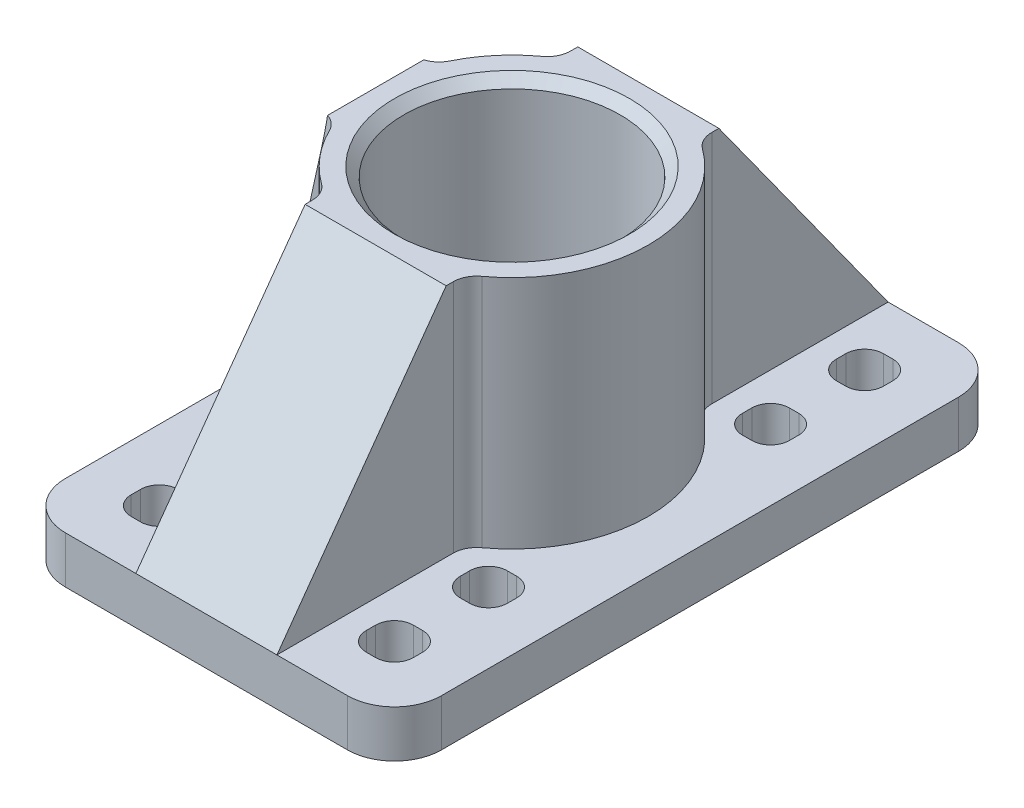
from build123d import *

# Parameters (mm, degrees)
SKETCH1_W                       = 40
SKETCH1_H                       = 65
SKETCH1_W_2                     = 5
SKETCH1_H_2                     = 5
MOUNTBASE_DEPTH                 = 5
SKETCH4_R                       = 11.5
PIPEBASE_DEPTH                  = 25
RIB3_REACH                      = 50.541
SKETCH6_WALL_W                  = 124.680290668
SKETCH6_WALL_H                  = 10
RIB5_REACH                      = 50.541
SKETCH7_WALL_W                  = 129.888282796
SKETCH7_WALL_H                  = 15
BASEFILLET_R                    = 5
PIPEFILLET_R                    = 2.5
INNERMATERIALREMOVAL_DEPTH      = 46.620718977
INNERMATERIALREMOVAL_DEPTH_BACK = 46.620718977
SKETCH8_R                       = 9
PIPECHAMFER_SIZE                = 1
FILLET5_R                       = 2
CUT_EXTRUDE2_START              = -25
CUT_EXTRUDE2_DEPTH              = 25
SKETCH10_W                      = 7
SKETCH10_H                      = 20
CUT_EXTRUDE3_DEPTH              = 3
FILLET6_R                       = 2


with BuildPart() as part:
    # Sketch1 → MountBase (new body)
    with BuildSketch(Plane(origin=(0, 0, 0), x_dir=(1, 0, 0), z_dir=(0, 1, 0))):
        Rectangle(SKETCH1_W, SKETCH1_H)
        with Locations((-12.5, 15)):
            Rectangle(SKETCH1_W_2, SKETCH1_H_2, mode=Mode.SUBTRACT)
        with Locations((-12.5, -15)):
            Rectangle(SKETCH1_W_2, SKETCH1_H_2, mode=Mode.SUBTRACT)
        with Locations((12.5, 15)):
            Rectangle(SKETCH1_W_2, SKETCH1_H_2, mode=Mode.SUBTRACT)
        with Locations((12.5, -15)):
            Rectangle(SKETCH1_W_2, SKETCH1_H_2, mode=Mode.SUBTRACT)
        with Locations((-12.5, -25)):
            Rectangle(SKETCH1_W_2, SKETCH1_H_2, mode=Mode.SUBTRACT)
        with Locations((12.5, -25)):
            Rectangle(SKETCH1_W_2, SKETCH1_H_2, mode=Mode.SUBTRACT)
        with Locations((-12.5, 25)):
            Rectangle(SKETCH1_W_2, SKETCH1_H_2, mode=Mode.SUBTRACT)
        with Locations((12.5, 25)):
            Rectangle(SKETCH1_W_2, SKETCH1_H_2, mode=Mode.SUBTRACT)
    extrude(amount=MOUNTBASE_DEPTH)

    # Sketch4 → PipeBase (add)
    with BuildSketch(Plane(origin=(0, 5, 0), x_dir=(1, 0, 0), z_dir=(0, 1, 0))):
        with BuildLine():
            Line((-14.5, 5), (-14.5, -5))
            Line((-14.5, -5), (-13.610657589, -5))
            ThreePointArc((-13.610657589, -5), (-11.186634071, -9.225465742), (-7.5, -12.409673646))
            Line((-7.5, -12.409673646), (-7.5, -14.5))
            Line((-7.5, -14.5), (7.5, -14.5))
            Line((7.5, -14.5), (7.5, -12.409673646))
            ThreePointArc((7.5, -12.409673646), (11.186634071, -9.225465742), (13.610657589, -5))
            Line((13.610657589, -5), (14.5, -5))
            Line((14.5, -5), (14.5, 5))
            Line((14.5, 5), (13.610657589, 5))
            ThreePointArc((13.610657589, 5), (11.186634071, 9.225465742), (7.5, 12.409673646))
            Line((7.5, 12.409673646), (7.5, 14.5))
            Line((7.5, 14.5), (-7.5, 14.5))
            Line((-7.5, 14.5), (-7.5, 12.409673646))
            ThreePointArc((-7.5, 12.409673646), (-11.186634071, 9.225465742), (-13.610657589, 5))
            Line((-13.610657589, 5), (-14.5, 5))
        make_face()
        with Locations(Location((0, 0, 0), (0, 0, 270))):
            Circle(SKETCH4_R, mode=Mode.SUBTRACT)
    extrude(amount=PIPEBASE_DEPTH)

    # Sketch6 wall → Rib3 (add, up to next)
    with BuildSketch(Plane(origin=(-17.25, 17.5, 0), x_dir=(-0.214861782675, -0.976644466705, 0), z_dir=(0.976644466705, -0.214861782675, 0)), mode=Mode.PRIVATE) as rib3_sk1:
        Rectangle(SKETCH6_WALL_W, SKETCH6_WALL_H)
    rib3_tool1 = extrude(rib3_sk1.sketch, amount=RIB3_REACH, mode=Mode.PRIVATE) - part.part
    rib3 = rib3_tool1.solids().sort_by_distance((-17.25, 17.5, 0))[0]
    add(rib3)

    # Mirror1: Rib3 across plane
    add(rib3.mirror(Plane(origin=(0, 0, 0), x_dir=(0, 0, 1), z_dir=(1, 0, 0))))

    # Sketch7 wall → Rib5 (add, up to next)
    with BuildSketch(Plane(origin=(0, 17.5, 23.5), x_dir=(0, -0.811534341451, 0.584304725845), z_dir=(0, -0.584304725845, -0.811534341451)), mode=Mode.PRIVATE) as rib5_sk1:
        Rectangle(SKETCH7_WALL_W, SKETCH7_WALL_H)
    rib5_tool1 = extrude(rib5_sk1.sketch, amount=RIB5_REACH, mode=Mode.PRIVATE) - part.part
    rib5 = rib5_tool1.solids().sort_by_distance((0, 17.5, 23.5))[0]
    add(rib5)

    # Mirror2: Rib5 across plane
    add(rib5.mirror(Plane.XY))

    # BaseFillet
    basefillet_edges = [part.edges().sort_by_distance(p)[0] for p in [
        (20, 2.5, 32.5),
        (-20, 2.5, 32.5),
        (-20, 2.5, -32.5),
        (20, 2.5, -32.5),
    ]]
    fillet(basefillet_edges, radius=BASEFILLET_R)

    # PipeFillet
    # the kernel refuses this fillet: 2.5 mm, written as the material it adds along each edge
    with BuildSketch(Plane(origin=(-13.610657589, 0.886278216, -5), x_dir=(-1, 0, 0), z_dir=(0, 1, 0))) as pipefillet_piece_1_section:
        with BuildLine():
            CenterArc((1.645488714, -2.5), PIPEFILLET_R, 90, 63.821031296)
            ThreePointArc((-0.598062213, -1.397058824), (-0.280715993, -0.706369867), (0, 0))
            Line((0, 0), (1.645488714, 0))
        make_face()
    pipefillet_piece_1 = extrude(amount=29.113721784, mode=Mode.PRIVATE)
    pipefillet_piece_1 = split(pipefillet_piece_1, bisect_by=Plane(origin=(-20.148077302, 4.326921354, -5.304724049), z_dir=(0.976644466705111, -0.2148617826750244, 0)), keep=Keep.TOP, mode=Mode.PRIVATE)
    add(pipefillet_piece_1)
    with BuildSketch(Plane(origin=(-7.5, 1.654866403, -12.409673646), x_dir=(-0.8330213423374977, 0, 0.5532408546105696), z_dir=(0, 1, 0))) as pipefillet_piece_2:
        with BuildLine():
            CenterArc((1.342287528, -2.497729208), PIPEFILLET_R, 92.442244575, 53.968120928)
            Line((-0.740265828, -1.114627072), (0, 0))
            ThreePointArc((0, 0), (0.617878386, -0.013170592), (1.235756772, 0))
        make_face()
    extrude(amount=28.345133597)
    with BuildSketch(Plane(origin=(-13.610657589, 0.886278216, 5), x_dir=(-1, 0, 0), z_dir=(0, 1, 0))) as pipefillet_piece_3_section:
        with BuildLine():
            CenterArc((1.645488714, 2.5), PIPEFILLET_R, 206.178968704, 63.821031296)
            ThreePointArc((-0.598062213, 1.397058824), (-0.280715993, 0.706369867), (0, 0))
            Line((0, 0), (1.645488714, 0))
        make_face()
    pipefillet_piece_3 = extrude(amount=29.113721784, mode=Mode.PRIVATE)
    pipefillet_piece_3 = split(pipefillet_piece_3, bisect_by=Plane(origin=(-20.148077302, 4.326921354, 5.304724049), z_dir=(0.976644466705111, -0.2148617826750244, 0)), keep=Keep.TOP, mode=Mode.PRIVATE)
    add(pipefillet_piece_3)
    with BuildSketch(Plane(origin=(-7.5, 1.654866403, 12.409673646), x_dir=(-0.8330213423374981, 0, -0.5532408546105689), z_dir=(0, 1, 0))) as pipefillet_piece_4:
        with BuildLine():
            CenterArc((1.342287528, 2.497729208), PIPEFILLET_R, 213.589634497, 53.968120928)
            Line((-0.740265828, 1.114627072), (0, 0))
            ThreePointArc((0, 0), (0.617878386, 0.013170592), (1.235756772, 0))
        make_face()
    extrude(amount=28.345133597)
    with BuildSketch(Plane(origin=(7.5, 1.654866403, 12.409673646), x_dir=(0, 0, 1), z_dir=(0, 1, 0))) as pipefillet_piece_5:
        with BuildLine():
            CenterArc((1.338053439, 2.5), PIPEFILLET_R, 216.031879072, 53.968120928)
            ThreePointArc((-0.683671132, 1.029411765), (-0.330864182, 0.521992392), (0, 0))
            Line((0, 0), (1.338053439, 0))
        make_face()
    extrude(amount=28.345133597)
    with BuildSketch(Plane(origin=(13.610657589, 0.886278216, 5), x_dir=(1, 0, 0), z_dir=(0, 1, 0))) as pipefillet_piece_6_section:
        with BuildLine():
            CenterArc((1.645488714, -2.5), PIPEFILLET_R, 90, 63.821031296)
            ThreePointArc((-0.598062213, -1.397058824), (-0.280715993, -0.706369867), (0, 0))
            Line((0, 0), (1.645488714, 0))
        make_face()
    pipefillet_piece_6 = extrude(amount=29.113721784, mode=Mode.PRIVATE)
    pipefillet_piece_6 = split(pipefillet_piece_6, bisect_by=Plane(origin=(20.148077302, 4.326921354, 5.304724049), z_dir=(-0.976644466705111, -0.21486178267502437, 0)), keep=Keep.TOP, mode=Mode.PRIVATE)
    add(pipefillet_piece_6)
    with BuildSketch(Plane(origin=(13.610657589, 0.886278216, -5), x_dir=(-0.3935427494511154, 0, -0.9193063169338371), z_dir=(0, 1, 0))) as pipefillet_piece_7_section:
        with BuildLine():
            CenterArc((1.65069564, -2.496565042), PIPEFILLET_R, 93.003848679, 63.821031296)
            Line((-0.647570153, -1.512708169), (0, 0))
            ThreePointArc((0, 0), (0.759844025, -0.019922754), (1.519688049, 0))
        make_face()
    pipefillet_piece_7 = extrude(amount=29.113721784, mode=Mode.PRIVATE)
    pipefillet_piece_7 = split(pipefillet_piece_7, bisect_by=Plane(origin=(20.148077302, 4.326921354, -5.304724049), z_dir=(-0.976644466705111, -0.21486178267502437, 0)), keep=Keep.TOP, mode=Mode.PRIVATE)
    add(pipefillet_piece_7)
    with BuildSketch(Plane(origin=(7.5, 1.654866403, -12.409673646), x_dir=(0, 0, -1), z_dir=(0, 1, 0))) as pipefillet_piece_8:
        with BuildLine():
            CenterArc((1.338053439, -2.5), PIPEFILLET_R, 90, 53.968120928)
            ThreePointArc((-0.683671132, -1.029411765), (-0.330864182, -0.521992392), (0, 0))
            Line((0, 0), (1.338053439, 0))
        make_face()
    extrude(amount=28.345133597)

    # Sketch8 → InnerMaterialRemoval (cut, two sides: drawn at the far end of the back side and taken through both)
    with BuildSketch(Plane(origin=(0, 5, 0), x_dir=(1, 0, 0), z_dir=(0, 1, 0)).offset(-INNERMATERIALREMOVAL_DEPTH_BACK)):
        with Locations(Location((0, 0, 0), (0, 0, 270))):
            Circle(SKETCH8_R)
    extrude(amount=INNERMATERIALREMOVAL_DEPTH + INNERMATERIALREMOVAL_DEPTH_BACK, mode=Mode.SUBTRACT)

    # PipeChamfer
    pipechamfer_edges = [part.edges().sort_by_distance(p)[0] for p in [
        (0, 30, -11.5),
    ]]
    chamfer(pipechamfer_edges, length=PIPECHAMFER_SIZE)

    # Fillet5
    fillet5_edges = [part.edges().sort_by_distance(p)[0] for p in [
        (10, 2.5, -27.5),
        (10, 2.5, -22.5),
        (15, 2.5, -22.5),
        (15, 2.5, -27.5),
        (-10, 2.5, -12.5),
        (-10, 2.5, -17.5),
        (-15, 2.5, -17.5),
        (-15, 2.5, -12.5),
        (-10, 2.5, 17.5),
        (-10, 2.5, 12.5),
        (-15, 2.5, 12.5),
        (-15, 2.5, 17.5),
        (15, 2.5, -12.5),
        (15, 2.5, -17.5),
        (10, 2.5, -17.5),
        (10, 2.5, -12.5),
        (15, 2.5, 17.5),
        (15, 2.5, 12.5),
        (10, 2.5, 12.5),
        (10, 2.5, 17.5),
        (-10, 2.5, 27.5),
        (-10, 2.5, 22.5),
        (-15, 2.5, 22.5),
        (-15, 2.5, 27.5),
        (15, 2.5, 27.5),
        (15, 2.5, 22.5),
        (10, 2.5, 22.5),
        (10, 2.5, 27.5),
        (-15, 2.5, -27.5),
        (-15, 2.5, -22.5),
        (-10, 2.5, -22.5),
        (-10, 2.5, -27.5),
    ]]
    fillet(fillet5_edges, radius=FILLET5_R)

    # Sketch9 → Cut-Extrude2 (cut)
    with BuildSketch(Plane(origin=(0, 30, 0), x_dir=(1, 0, 0), z_dir=(0, 1, 0)).offset(CUT_EXTRUDE2_START)):
        with BuildLine():
            Line((7.5, -13.747727085), (8.27770049, -13.747727085))
            Line((8.27770049, -13.747727085), (20, -7.665046243))
            Line((20, -7.665046243), (20, 7.665046243))
            Line((20, 7.665046243), (8.27770049, 13.747727085))
            Line((8.27770049, 13.747727085), (7.5, 13.747727085))
            ThreePointArc((7.5, 13.747727085), (7.772168028, 12.613370569), (8.529411765, 11.726002514))
            ThreePointArc((8.529411765, 11.726002514), (11.095671594, 9.334670422), (13.012595376, 6.397058824))
            ThreePointArc((13.012595376, 6.397058824), (13.625464362, 5.605039206), (14.5, 5.11709363))
            Line((14.5, 5.11709363), (14.5, -5.11709363))
            ThreePointArc((14.5, -5.11709363), (13.625464362, -5.605039206), (13.012595376, -6.397058824))
            ThreePointArc((13.012595376, -6.397058824), (11.095671594, -9.334670422), (8.529411765, -11.726002514))
            ThreePointArc((8.529411765, -11.726002514), (7.772168028, -12.613370569), (7.5, -13.747727085))
        make_face()
        with BuildLine():
            ThreePointArc((14.5, 5.11709363), (13.625464362, 5.605039206), (13.012595376, 6.397058824))
            ThreePointArc((13.012595376, 6.397058824), (14.123254458, 3.283851934), (14.5, 0))
            Line((14.5, 0), (14.5, 5.11709363))
        make_face()
        with BuildLine():
            Line((14.5, -5.11709363), (14.5, 0))
            ThreePointArc((14.5, 0), (14.123254458, -3.283851934), (13.012595376, -6.397058824))
            ThreePointArc((13.012595376, -6.397058824), (13.625464362, -5.605039206), (14.5, -5.11709363))
        make_face()
    extrude(amount=CUT_EXTRUDE2_DEPTH, mode=Mode.SUBTRACT)

    # Sketch10 → Cut-Extrude3 (cut)
    with BuildSketch(Plane.XZ):
        with Locations((14.5, 0)):
            Rectangle(SKETCH10_W, SKETCH10_H)
    extrude(amount=-CUT_EXTRUDE3_DEPTH, mode=Mode.SUBTRACT)

    # Fillet6
    fillet6_edges = [part.edges().sort_by_distance(p)[0] for p in [
        (18, 1.5, 10),
        (18, 1.5, -10),
        (11, 1.5, -10),
        (11, 1.5, 10),
    ]]
    fillet(fillet6_edges, radius=FILLET6_R)


solid = part.part
